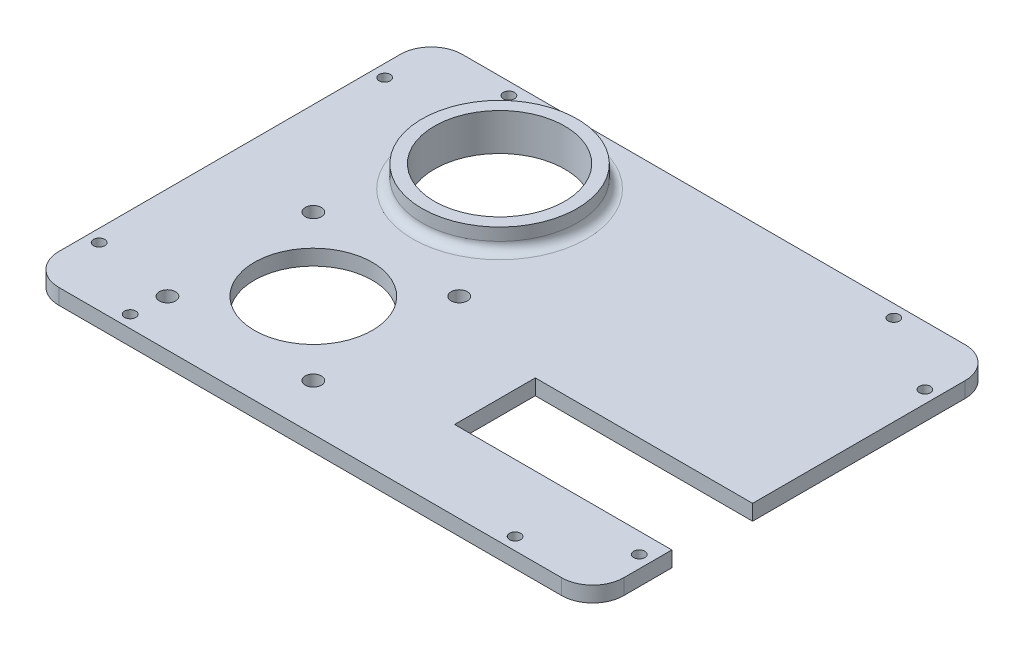
from build123d import *

# Parameters (mm, degrees)
SKETCH1_R           = 2.6
SKETCH1_R_2         = 19
SKETCH1_R_3         = 21
BOSS_EXTRUDE1_DEPTH = 5
SKETCH2_R           = 25
SKETCH2_R_2         = 21
BOSS_EXTRUDE2_DEPTH = 7
FILLET1_R           = 3
SKETCH4_R           = 1.8
CUT_EXTRUDE1_DEPTH  = 158.903451514


with BuildPart() as part:
    # Sketch1 → Boss-Extrude1 (new body)
    with BuildSketch(Plane(origin=(0, 0, 0), x_dir=(1, 0, 0), z_dir=(0, 1, 0))):
        with BuildLine():
            Line((58.5, 13), (128.5, 13))
            Line((128.5, 13), (128.5, 81.5))
            ThreePointArc((128.5, 81.5), (125.571067812, 88.571067812), (118.5, 91.5))
            Line((118.5, 91.5), (-43.5, 91.5))
            ThreePointArc((-43.5, 91.5), (-50.571067812, 88.571067812), (-53.5, 81.5))
            Line((-53.5, 81.5), (-53.5, -28.5))
            ThreePointArc((-53.5, -28.5), (-50.571067812, -35.571067812), (-43.5, -38.5))
            Line((-43.5, -38.5), (118.5, -38.5))
            ThreePointArc((118.5, -38.5), (125.571067812, -35.571067812), (128.5, -28.5))
            Line((128.5, -28.5), (128.5, -13))
            Line((128.5, -13), (58.5, -13))
            Line((58.5, -13), (58.5, 13))
        make_face()
        with Locations((-23.5, -23.5)):
            Circle(SKETCH1_R, mode=Mode.SUBTRACT)
        with Locations((23.5, -23.5)):
            Circle(SKETCH1_R, mode=Mode.SUBTRACT)
        with Locations((-23.5, 23.5)):
            Circle(SKETCH1_R, mode=Mode.SUBTRACT)
        Circle(SKETCH1_R_2, mode=Mode.SUBTRACT)
        with Locations((23.5, 23.5)):
            Circle(SKETCH1_R, mode=Mode.SUBTRACT)
        with Locations((0, 60)):
            Circle(SKETCH1_R_3, mode=Mode.SUBTRACT)
    extrude(amount=BOSS_EXTRUDE1_DEPTH)

    # Sketch2 → Boss-Extrude2 (add)
    with BuildSketch(Plane(origin=(0, 5, 0), x_dir=(1, 0, 0), z_dir=(0, 1, 0))):
        with Locations((0, 60)):
            Circle(SKETCH2_R)
        with Locations((0, 60)):
            Circle(SKETCH2_R_2, mode=Mode.SUBTRACT)
    extrude(amount=BOSS_EXTRUDE2_DEPTH)

    # Fillet1
    fillet1_edges = [part.edges().sort_by_distance(p)[0] for p in [
        (-25, 5, -60),
    ]]
    fillet(fillet1_edges, radius=FILLET1_R)

    # Sketch4 → Cut-Extrude1 (cut, through all)
    with BuildSketch(Plane(origin=(0, 5, 0), x_dir=(1, 0, 0), z_dir=(0, 1, 0))):
        with Locations((-49.5, -19.5)):
            Circle(SKETCH4_R)
        with Locations((-24.5, -34.5)):
            Circle(SKETCH4_R)
        with Locations((-24.5, 87.5)):
            Circle(SKETCH4_R)
        with Locations((-49.5, 72.5)):
            Circle(SKETCH4_R)
        with Locations((99.5, -34.5)):
            Circle(SKETCH4_R)
        with Locations((124.5, -19.5)):
            Circle(SKETCH4_R)
        with Locations((124.5, 72.5)):
            Circle(SKETCH4_R)
        with Locations((99.5, 87.5)):
            Circle(SKETCH4_R)
    extrude(amount=-CUT_EXTRUDE1_DEPTH, mode=Mode.SUBTRACT)


solid = part.part
